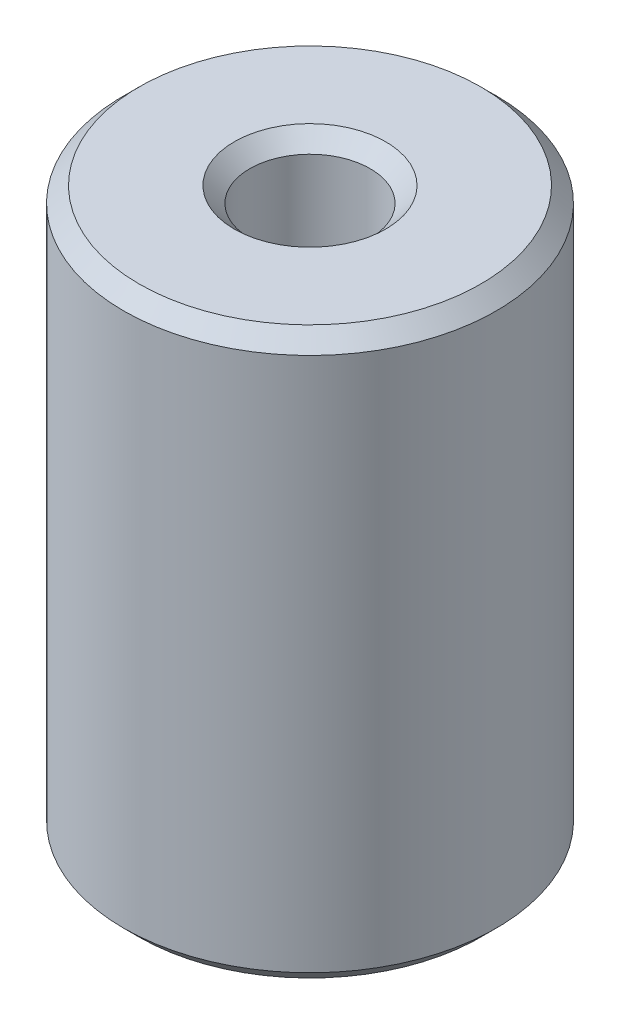
from build123d import *

# Parameters (mm, degrees)
SKETCH1_R           = 5
BOSS_EXTRUDE1_DEPTH = 15.179221742
SKETCH2_R           = 1.615383833
CUT_EXTRUDE1_DEPTH  = 17.745410496
CHAMFER1_SIZE       = 0.416594562


with BuildPart() as part:
    # Sketch1 → Boss-Extrude1 (new body)
    with BuildSketch(Plane(origin=(0, 0, 0), x_dir=(1, 0, 0), z_dir=(0, 1, 0))):
        Circle(SKETCH1_R)
    extrude(amount=BOSS_EXTRUDE1_DEPTH)

    # Sketch2 → Cut-Extrude1 (cut, through all)
    with BuildSketch(Plane(origin=(0, 0, 0), x_dir=(1, 0, 0), z_dir=(0, 1, 0))):
        Circle(SKETCH2_R)
    extrude(amount=CUT_EXTRUDE1_DEPTH, mode=Mode.SUBTRACT)

    # Chamfer1
    chamfer1_edges = [part.edges().sort_by_distance(p)[0] for p in [
        (-1.615383833, 15.179221742, 0),
        (-1.615383833, 0, 0),
        (-5, 0, 0),
        (-5, 15.179221742, 0),
    ]]
    chamfer(chamfer1_edges, length=CHAMFER1_SIZE)


solid = part.part
